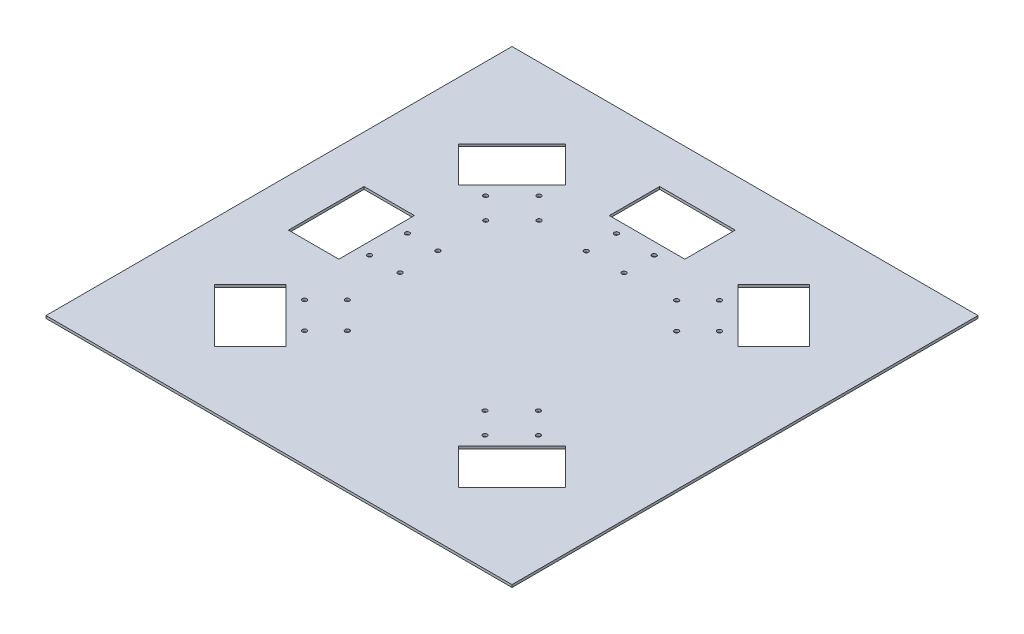
from build123d import *

# Parameters (mm, degrees)
SKETCH1_W           = 370
SKETCH1_H           = 370
SKETCH1_W_2         = 60
SKETCH1_H_2         = 40
SKETCH1_W_3         = 40
SKETCH1_H_3         = 60
SKETCH1_R           = 1.75
BOSS_EXTRUDE2_DEPTH = 2


with BuildPart() as part:
    # Sketch1 → Boss-Extrude2 (new body)
    with BuildSketch(Plane(origin=(0, 0, 0), x_dir=(1, 0, 0), z_dir=(0, 1, 0))):
        Rectangle(SKETCH1_W, SKETCH1_H)
        with Locations((-0.133661265, 127.376507427)):
            Rectangle(SKETCH1_W_2, SKETCH1_H_2, mode=Mode.SUBTRACT)
        with Locations((-127.500000449, 0)):
            Rectangle(SKETCH1_W_3, SKETCH1_H_3, mode=Mode.SUBTRACT)
        with Locations((71.5931181, -93.078808311)):
            Circle(SKETCH1_R, mode=Mode.SUBTRACT)
        with Locations((54.622555352, -76.108245563)):
            Circle(SKETCH1_R, mode=Mode.SUBTRACT)
        with Locations((75.835758788, -54.895042127)):
            Circle(SKETCH1_R, mode=Mode.SUBTRACT)
        with Locations((92.806321536, -71.865604876)):
            Circle(SKETCH1_R, mode=Mode.SUBTRACT)
        Polygon((-68.582262997, -110.999199603), (-96.866534244, -139.28347085), (-139.290314967, -96.859690128), (-111.006043719, -68.575418881), align=None, mode=Mode.SUBTRACT)
        Polygon((110.999199603, -68.582262997), (139.28347085, -96.866534244), (96.859690128, -139.290314967), (68.575418881, -111.006043719), align=None, mode=Mode.SUBTRACT)
        Polygon((-110.999199603, 68.582262997), (-139.28347085, 96.866534244), (-96.859690128, 139.290314967), (-68.575418881, 111.006043719), align=None, mode=Mode.SUBTRACT)
        Polygon((68.582262997, 110.999199603), (96.866534244, 139.28347085), (139.290314967, 96.859690128), (111.006043719, 68.575418881), align=None, mode=Mode.SUBTRACT)
        with Locations((-14.940526024, 97.876024947)):
            Circle(SKETCH1_R, mode=Mode.SUBTRACT)
        with Locations((15.182965202, 73.807380609)):
            Circle(SKETCH1_R, mode=Mode.SUBTRACT)
        with Locations((15.059473976, 97.876024947)):
            Circle(SKETCH1_R, mode=Mode.SUBTRACT)
        with Locations((-14.817034798, 73.807380609)):
            Circle(SKETCH1_R, mode=Mode.SUBTRACT)
        with Locations((76.108245563, 54.622555352)):
            Circle(SKETCH1_R, mode=Mode.SUBTRACT)
        with Locations((54.895042127, 75.835758788)):
            Circle(SKETCH1_R, mode=Mode.SUBTRACT)
        with Locations((93.078808311, 71.5931181)):
            Circle(SKETCH1_R, mode=Mode.SUBTRACT)
        with Locations((71.865604876, 92.806321536)):
            Circle(SKETCH1_R, mode=Mode.SUBTRACT)
        with Locations((-93.078808311, -71.5931181)):
            Circle(SKETCH1_R, mode=Mode.SUBTRACT)
        with Locations((-54.895042127, -75.835758788)):
            Circle(SKETCH1_R, mode=Mode.SUBTRACT)
        with Locations((-76.108245563, -54.622555352)):
            Circle(SKETCH1_R, mode=Mode.SUBTRACT)
        with Locations((-71.865604876, -92.806321536)):
            Circle(SKETCH1_R, mode=Mode.SUBTRACT)
        with Locations((-73.930871834, -14.940526024)):
            Circle(SKETCH1_R, mode=Mode.SUBTRACT)
        with Locations((-97.999516173, 14.935982751)):
            Circle(SKETCH1_R, mode=Mode.SUBTRACT)
        with Locations((-73.930871834, 15.059473976)):
            Circle(SKETCH1_R, mode=Mode.SUBTRACT)
        with Locations((-97.999516173, -15.064017249)):
            Circle(SKETCH1_R, mode=Mode.SUBTRACT)
        with Locations((-54.622555352, 76.108245563)):
            Circle(SKETCH1_R, mode=Mode.SUBTRACT)
        with Locations((-71.5931181, 93.078808311)):
            Circle(SKETCH1_R, mode=Mode.SUBTRACT)
        with Locations((-92.806321536, 71.865604876)):
            Circle(SKETCH1_R, mode=Mode.SUBTRACT)
        with Locations((-75.835758788, 54.895042127)):
            Circle(SKETCH1_R, mode=Mode.SUBTRACT)
    extrude(amount=BOSS_EXTRUDE2_DEPTH)


solid = part.part
